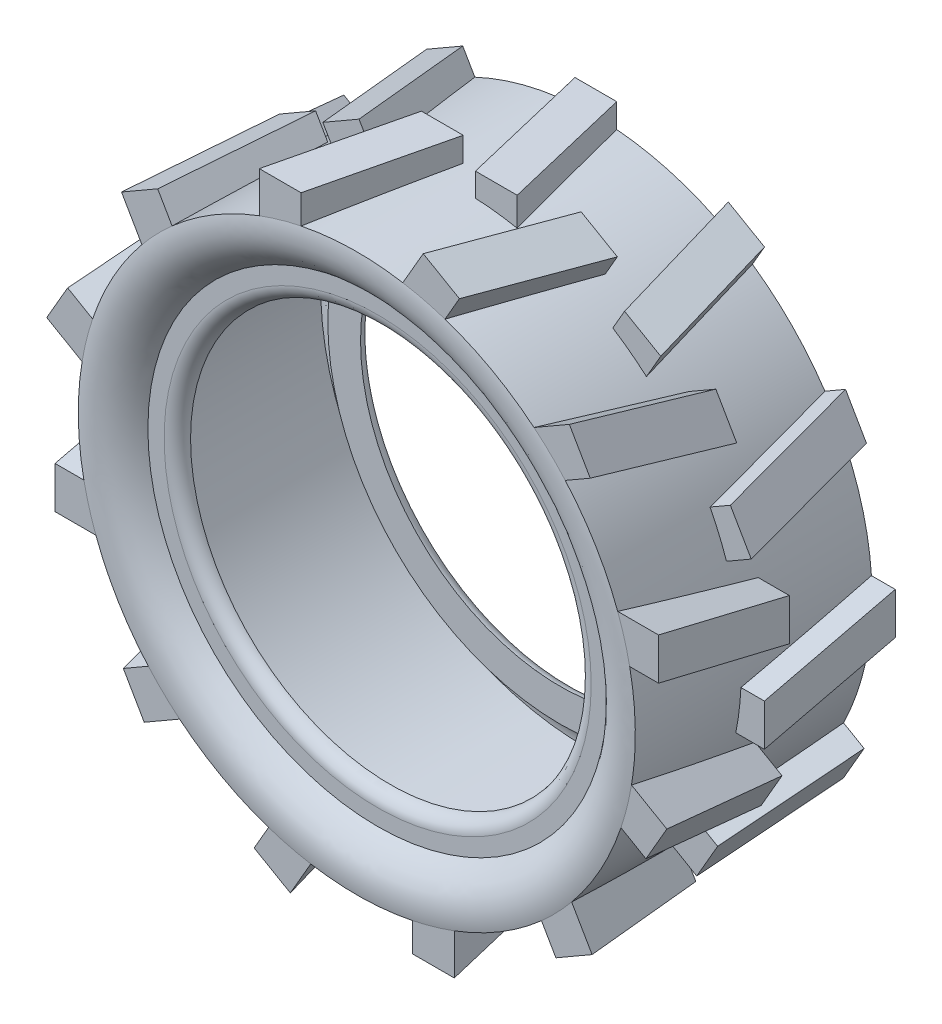
from build123d import *

# Parameters (mm, degrees)
EXTRUDE_1_REACH          = 143.027
EXTRUDE_1_END_RADIUS     = 60
PATTERN_CIRCULAR_1_COUNT = 12


with BuildPart() as part:
    # Эскиз1 → Повернуть1 (revolve)
    with BuildSketch(Plane(origin=(0, 0, 0), x_dir=(0, 0, -1), z_dir=(1, 0, 0))):
        with BuildLine():
            Line((0, 60), (25.5, 60))
            add(Edge.make_bspline(
                [(25.5, 60), (26.87392414, 53.731531383), (21, 49.5)],
                knots=[0, 0, 0, 1, 1, 1], degree=2))
            Line((21, 49.5), (21, 46))
            ThreePointArc((21, 46), (20.233438311, 43.981012926), (18.309499833, 43))
            Line((18.309499833, 43), (18.309499833, 46))
            Line((18.309499833, 46), (18.309499833, 50.052245881))
            Line((18.309499833, 50.052245881), (19.830971021, 51.122766541))
            add(Edge.make_bspline(
                [(23.727210277, 57.000001924), (23.698095797, 56.695947897), (23.549438985, 55.802338787), (23.114489215, 54.672185135), (22.402847503, 53.561439088), (21.715390804, 52.73438959), (20.880135901, 51.926289864), (20.180202764, 51.374350498), (19.830971021, 51.122766541)],
                knots=[0.266180621, 0.266180621, 0.266180621, 0.266180621, 0.367957178, 0.578638119, 0.683978589, 0.789319059, 0.89465953, 1, 1, 1, 1], degree=3))
            Line((23.727210277, 57.000001924), (0, 57.000001924))
            Line((0, 57.000001924), (-23.727247353, 57))
            add(Edge.make_bspline(
                [(-23.727247353, 57), (-23.698095969, 56.695948927), (-23.549439173, 55.802339274), (-23.114489215, 54.672185135), (-22.402847503, 53.561439088), (-21.715390804, 52.73438959), (-20.880135901, 51.926289864), (-20.180202764, 51.374350498), (-19.830971021, 51.122766541)],
                knots=[0.266180441, 0.266180441, 0.266180441, 0.266180441, 0.367957178, 0.578638119, 0.683978589, 0.789319059, 0.89465953, 1, 1, 1, 1], degree=3))
            Line((-19.830971021, 51.122766541), (-18.309499833, 50.052245881))
            Line((-18.309499833, 50.052245881), (-18.309499833, 46))
            Line((-18.309499833, 46), (-18.309499833, 43))
            ThreePointArc((-18.309499833, 43), (-20.233438311, 43.981012926), (-21, 46))
            Line((-21, 46), (-21, 49.5))
            add(Edge.make_bspline(
                [(-25.5, 60), (-26.87392414, 53.731531383), (-21, 49.5)],
                knots=[0, 0, 0, 1, 1, 1], degree=2))
            Line((-25.5, 60), (0, 60))
        make_face()
    revolve(axis=Axis((0, 0, 131.047552284), (0, 0, -1)))

    # Бобышка-Вытянуть1: up to this cylinder (the profile starts outside it)
    extrude_1_end = Plane(origin=(0, 0, 0), z_dir=(0, 0, 1)) * Cylinder(EXTRUDE_1_END_RADIUS, 429.86818, mode=Mode.PRIVATE)
    # Эскиз2 → Бобышка-Вытянуть1 (add, up to the surface)
    with BuildSketch(Plane(origin=(0, 65, 0), x_dir=(1, 0, 0), z_dir=(0, 1, 0)), mode=Mode.PRIVATE) as extrude_1_sk1:
        Polygon((-5.259945351, 2.685820354), (-12, -25.5), (-21, -25.5), (-14.259945351, 2.685820354), align=None)
    extrude_1_tool1 = extrude(extrude_1_sk1.sketch, amount=-EXTRUDE_1_REACH, mode=Mode.PRIVATE) - extrude_1_end
    # Эскиз2 → Бобышка-Вытянуть1 (add, up to the surface)
    with BuildSketch(Plane(origin=(0, 65, 0), x_dir=(1, 0, 0), z_dir=(0, 1, 0)), mode=Mode.PRIVATE) as extrude_1_sk2:
        Polygon((5, 25.5), (-4, 25.5), (2.740054649, -2.685820354), (11.740054649, -2.685820354), align=None)
    extrude_1_tool2 = extrude(extrude_1_sk2.sketch, amount=-EXTRUDE_1_REACH, mode=Mode.PRIVATE) - extrude_1_end
    extrude_1 = extrude_1_tool1.solids().sort_by_distance((-13.129973, 65, 11.40709))[0] + extrude_1_tool2.solids().sort_by_distance((3.870027, 65, -11.40709))[0]
    add(extrude_1)

    # Круговой массив1: Бобышка-Вытянуть1 ×12 about axis
    pattern_circular_1_axis = Axis((0, 0, 131.047552284), (0, 0, 1))
    for i in range(1, PATTERN_CIRCULAR_1_COUNT):
        add(extrude_1.rotate(pattern_circular_1_axis, i * 360 / PATTERN_CIRCULAR_1_COUNT))


solid = part.part
